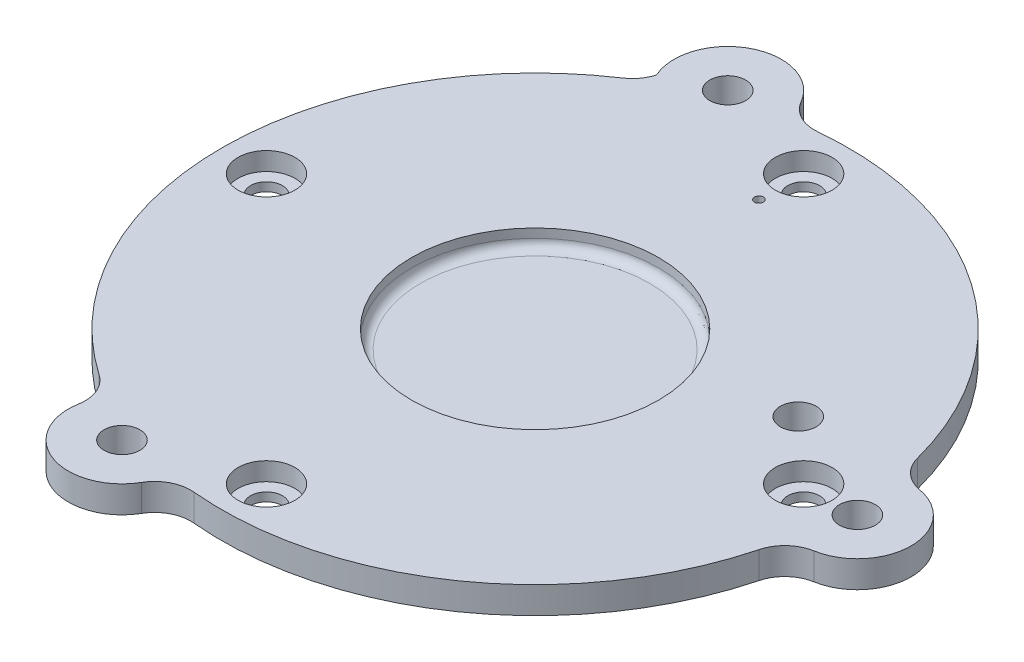
from build123d import *

# Parameters (mm, degrees)
SKETCH1_R                                      = 17.5
BOSS_EXTRUDE1_DEPTH                            = 1.5
CUT_EXTRUDE1_DEPTH                             = 25.794152536
CUT_EXTRUDE1_DEPTH_BACK                        = 25.794152536
SKETCH6_R                                      = 0.25
SKETCH6_R_2                                    = 1
CBORE_FOR_0_SOCKET_HEAD_CAP_SCREW1_D           = 1.778
CBORE_FOR_0_SOCKET_HEAD_CAP_SCREW1_CBORE_D     = 3.175
CBORE_FOR_0_SOCKET_HEAD_CAP_SCREW1_CBORE_DEPTH = 1.016
BOSS_EXTRUDE2_START                            = -1.5
BOSS_EXTRUDE2_DEPTH                            = 1.5
FILLET1_DEPTH                                  = 1.5
CUT_EXTRUDE2_START                             = -10
SKETCH16_R                                     = 1
CUT_EXTRUDE2_DEPTH                             = 10
SKETCH17_R                                     = 6.9
CUT_EXTRUDE3_DEPTH                             = 1
FILLET2_R                                      = 0.5


with BuildPart() as part:
    # Sketch1 → Boss-Extrude1 (new body)
    with BuildSketch(Plane(origin=(0, 0, 0), x_dir=(1, 0, 0), z_dir=(0, 1, 0))):
        with Locations(Location((0, 0, 0), (0, 0, 270))):
            Circle(SKETCH1_R)
    extrude(amount=BOSS_EXTRUDE1_DEPTH)

    # Sketch6 → Cut-Extrude1 (cut, two sides: drawn at the far end of the back side and taken through both)
    with BuildSketch(Plane(origin=(0, 1.5, 0), x_dir=(1, 0, 0), z_dir=(0, 1, 0)).offset(-CUT_EXTRUDE1_DEPTH_BACK)):
        with Locations(Location((0, 12.5, 0), (0, 0, 270))):
            Circle(SKETCH6_R)
        with Locations(Location((11.591109915, 3.105828541, 0), (0, 0, 270))):
            Circle(SKETCH6_R_2)
    extrude(amount=CUT_EXTRUDE1_DEPTH + CUT_EXTRUDE1_DEPTH_BACK, mode=Mode.SUBTRACT)

    # CBORE for #0 Socket Head Cap Screw1 (through all)
    with Locations(Plane(origin=(0, 1.5, 0), x_dir=(1, 0, 0), z_dir=(0, 1, 0))):
        with Locations((0, 15), (-15, 0), (0, -15), (15, 0)):
            CounterBoreHole(CBORE_FOR_0_SOCKET_HEAD_CAP_SCREW1_D / 2, CBORE_FOR_0_SOCKET_HEAD_CAP_SCREW1_CBORE_D / 2, CBORE_FOR_0_SOCKET_HEAD_CAP_SCREW1_CBORE_DEPTH)

    # Sketch15 → Boss-Extrude2 (add)
    # profile 1 of 3: a face of its own
    with BuildSketch(Plane(origin=(0, 1.5, 0), x_dir=(1, 0, 0), z_dir=(0, 1, 0)).offset(BOSS_EXTRUDE2_START)):
        with BuildLine():
            ThreePointArc((-5.176050603, 16.717012297), (-4.139884011, 17.00327499), (-3.0880962, 17.225378424))
            Line((-3.0880962, 17.225378424), (-3.2615852, 17.702035532))
            ThreePointArc((-3.2615852, 17.702035532), (-7.18242301, 19.733545037), (-8.880129888, 15.657052506))
            ThreePointArc((-8.880129888, 15.657052506), (-8.884731942, 15.654441488), (-8.889333228, 15.651829119))
            Line((-8.889333228, 15.651829119), (-8.715826512, 15.175123334))
            ThreePointArc((-8.715826512, 15.175123334), (-7.762905696, 15.68398212), (-6.780403574, 16.133075571))
            ThreePointArc((-6.780403574, 16.133075571), (-6.498382723, 17.854159795), (-5.176050603, 16.717012297))
        make_face()
    # profile 2 of 3: a face of its own
    with BuildSketch(Plane(origin=(0, 1.5, 0), x_dir=(1, 0, 0), z_dir=(0, 1, 0)).offset(BOSS_EXTRUDE2_START)):
        with BuildLine():
            ThreePointArc((17.242700391, 2.989863415), (17.499999999, 0.00015134), (17.242752101, -2.989565186))
            Line((17.242752101, -2.989565186), (17.75, -2.989565186))
            ThreePointArc((17.75, -2.989565186), (21, 0), (17.75, 2.989565186))
            Line((17.75, 2.989565186), (17.242700391, 2.989863415))
        make_face()
        with BuildLine():
            ThreePointArc((17.972222222, 0.999614123), (19, 0), (17.972222222, -0.999614123))
            ThreePointArc((17.972222222, -0.999614123), (18, 0), (17.972222222, 0.999614123))
        make_face(mode=Mode.SUBTRACT)
    # profile 3 of 3: a face of its own
    with BuildSketch(Plane(origin=(0, 1.5, 0), x_dir=(1, 0, 0), z_dir=(0, 1, 0)).offset(BOSS_EXTRUDE2_START)):
        with BuildLine():
            ThreePointArc((-8.880129888, -15.657052506), (-6.943930938, -19.809244554), (-3.170985611, -17.210312323))
            ThreePointArc((-3.170985611, -17.210312323), (-4.180800117, -16.993260734), (-5.176050603, -16.717012297))
            ThreePointArc((-5.176050603, -16.717012297), (-6.498382723, -17.854159795), (-6.780403574, -16.133075571))
            ThreePointArc((-6.780403574, -16.133075571), (-7.758295007, -15.686263372), (-8.706903461, -15.180244798))
            Line((-8.706903461, -15.180244798), (-8.880129888, -15.657052506))
        make_face()
    extrude(amount=BOSS_EXTRUDE2_DEPTH)

    # Fillet1: read off the stored shape, not the designer's step
    # Fillet1 outline → Fillet1 (add)
    with BuildSketch(Plane(origin=(0, 0, 0), x_dir=(1, 0, 0), z_dir=(0, 1, 0))):
        with BuildLine():
            ThreePointArc((-8.889333228, 15.651829119), (-9.197952649, 15.040582781), (-9.694667487, 14.56926293))
            ThreePointArc((-9.694667487, 14.56926293), (-9.210230129, 14.880243982), (-8.715826512, 15.175123334))
            Line((-8.715826512, 15.175123334), (-8.889333228, 15.651829119))
        make_face()
        with BuildLine():
            ThreePointArc((-9.943920594, -14.400293164), (-9.235099699, -15.274689897), (-9.110766229, -16.393411442))
            ThreePointArc((-9.110766229, -16.393411442), (-9.019221723, -16.017785781), (-8.880129888, -15.657052506))
            Line((-8.880129888, -15.657052506), (-8.706903461, -15.180244798))
            ThreePointArc((-8.706903461, -15.180244798), (-9.33356259, -14.803195918), (-9.943920594, -14.400293164))
        make_face()
        with BuildLine():
            ThreePointArc((-3.0880962, 17.225378424), (-2.365537121, 17.339383902), (-1.638844908, 17.423093507))
            ThreePointArc((-1.638844908, 17.423093507), (-2.743884601, 17.637298977), (-3.558229913, 18.414369386))
            ThreePointArc((-3.558229913, 18.414369386), (-3.386909552, 18.067779761), (-3.2615852, 17.702035532))
            Line((-3.2615852, 17.702035532), (-3.0880962, 17.225378424))
        make_face()
        with BuildLine():
            ThreePointArc((17.75, 2.989565186), (18.136550606, 2.996890711), (18.520833333, 2.954442865))
            ThreePointArc((18.520833333, 2.954442865), (17.512103504, 3.453903412), (16.93287037, 4.419038472))
            ThreePointArc((16.93287037, 4.419038472), (17.102720385, 3.707688694), (17.242700391, 2.989863415))
            Line((17.242700391, 2.989863415), (17.75, 2.989565186))
        make_face()
        with BuildLine():
            ThreePointArc((17.242752101, -2.989565186), (17.102752448, -3.70754079), (16.932870371, -4.419038472))
            ThreePointArc((16.932870371, -4.419038472), (17.512103504, -3.453903412), (18.520833333, -2.954442864))
            ThreePointArc((18.520833333, -2.954442864), (18.136550606, -2.996890711), (17.75, -2.989565186))
            Line((17.75, -2.989565186), (17.242752101, -2.989565186))
        make_face()
        with BuildLine():
            ThreePointArc((-3.558229913, -18.414369386), (-2.743884601, -17.637298977), (-1.638844908, -17.423093507))
            ThreePointArc((-1.638844908, -17.423093507), (-2.407267406, -17.333639653), (-3.170985611, -17.210312323))
            ThreePointArc((-3.170985611, -17.210312323), (-3.300433079, -17.832980475), (-3.558229913, -18.414369386))
        make_face()
    extrude(amount=FILLET1_DEPTH)

    # Sketch16 → Cut-Extrude2 (cut)
    with BuildSketch(Plane(origin=(0, 1.5, 0), x_dir=(1, 0, 0), z_dir=(0, 1, 0)).offset(CUT_EXTRUDE2_START)):
        with Locations(Location((-6.15636258, 16.914467174, 0), (0, 0, 270))):
            Circle(SKETCH16_R)
        with Locations(Location((18, 0, 0), (0, 0, 270))):
            Circle(SKETCH16_R)
        with Locations(Location((-6.15636258, -16.914467174, 0), (0, 0, 270))):
            Circle(SKETCH16_R)
    extrude(amount=CUT_EXTRUDE2_DEPTH, mode=Mode.SUBTRACT)

    # Sketch17 → Cut-Extrude3 (cut)
    with BuildSketch(Plane(origin=(0, 1.5, 0), x_dir=(1, 0, 0), z_dir=(0, 1, 0))):
        with Locations(Location((0, 0, 0), (0, 0, 270))):
            Circle(SKETCH17_R)
    extrude(amount=-CUT_EXTRUDE3_DEPTH, mode=Mode.SUBTRACT)

    # Fillet2
    fillet2_edges = [part.edges().sort_by_distance(p)[0] for p in [
        (0, 0.5, -6.9),
    ]]
    fillet(fillet2_edges, radius=FILLET2_R)


solid = part.part
